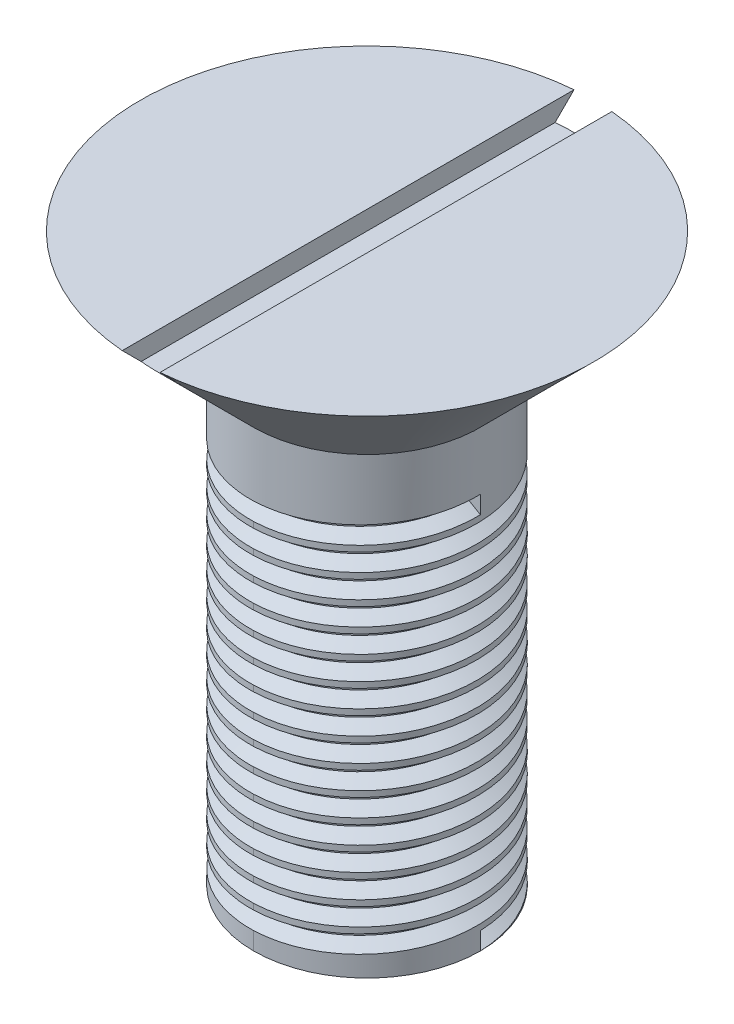
from build123d import *

# Parameters (mm, degrees)
THREAD1_PITCH      = 1.25
SKETCH3_W          = 2
SKETCH3_H          = 30
CUT_EXTRUDE1_DEPTH = 1


with BuildPart() as part:
    # Sketch2 → Revolve1 (revolve)
    with BuildSketch(Plane.XY, mode=Mode.PRIVATE) as revolve1_sk:
        Polygon((0, -52.720097994), (0, -22.720097994), (12, -22.720097994), (6, -28.720097994), (6, -52.720097994), align=None)
    revolve(revolve1_sk.sketch.rotate(Axis((0, 53.753825406, 0), (0, -1, 0)), 90), axis=Axis((0, 53.753825406, 0), (0, -1, 0)))

    # Thread1: the profile of Thread Profile1 profile screwed along a right-hand helix of 16 turns, 8 arcs to a turn; built about Z, then put on its axis
    thread1_z = Axis((0, 0, 0), (0, 0, 1))
    thread1_corners = [(6.0003, 0, -0.000173205), (5.323417656, 0, 0.390624998), (5.323417656, 0, 0.546874998), (6.0003, 0, 0.937673201)]
    with BuildLine(mode=Mode.PRIVATE) as thread1_profile:
        Line(thread1_corners[0], thread1_corners[1])
        Line(thread1_corners[1], thread1_corners[2])
        Line(thread1_corners[2], thread1_corners[3])
        Line(thread1_corners[3], thread1_corners[0])
    thread1_cap = Face(thread1_profile.wire())
    thread1_turn_angles = [0, 22.5, 45, 67.5, 90, 112.5, 135, 157.5, 180, 202.5, 225, 247.5, 270, 292.5, 315, 337.5, 360]
    thread1_turn_weights = [1, 0.9238795325112867, 1, 0.9238795325112867, 1, 0.9238795325112867, 1, 0.9238795325112867, 1, 0.9238795325112867, 1, 0.9238795325112867, 1, 0.9238795325112867, 1, 0.9238795325112867, 1]
    thread1_turn_rails = [Edge.make_bspline([Vector(p[0], p[1], 0).rotate(thread1_z, thread1_turn_angles[k]) / thread1_turn_weights[k] + Vector(0, 0, p[2] + THREAD1_PITCH * thread1_turn_angles[k] / 360) for k in range(17)], [0, 0, 0, 1, 1, 2, 2, 3, 3, 4, 4, 5, 5, 6, 6, 7, 7, 8, 8, 8], 2, thread1_turn_weights) for p in thread1_corners]
    thread1_turn_sides = [Face.make_surface_from_curves(thread1_turn_rails[p[0]], thread1_turn_rails[p[1]]) for p in [(0, 1), (1, 2), (2, 3), (3, 0)]]
    thread1 = Plane(origin=(0, -52.720097994, 0), x_dir=(1, 0, 0), z_dir=(0, 1, 0)) * Solid(Shell([*[p.moved(Location((0, 0, THREAD1_PITCH * i))) for i in range(16) for p in thread1_turn_sides], thread1_cap, thread1_cap.rotate(thread1_z, 5760).moved(Location((0, 0, THREAD1_PITCH * 5760 / 360)))]))
    add(thread1, mode=Mode.SUBTRACT)

    # Sketch3 → Cut-Extrude1 (cut)
    with BuildSketch(Plane(origin=(0, -22.720097994, 0), x_dir=(1, 0, 0), z_dir=(0, 1, 0))):
        Rectangle(SKETCH3_W, SKETCH3_H)
    extrude(amount=-CUT_EXTRUDE1_DEPTH, mode=Mode.SUBTRACT)


solid = part.part
